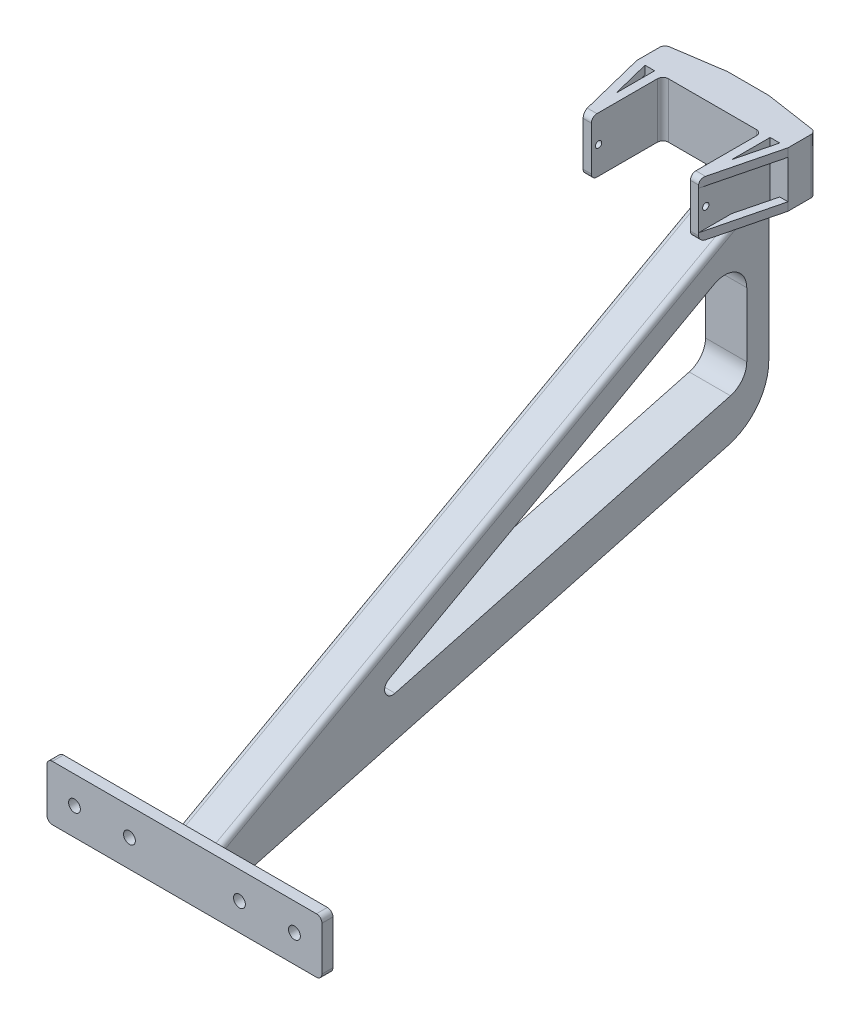
from build123d import *

# Parameters (mm, degrees)
SKETCH1_W           = 100
SKETCH1_H           = 20
SKETCH1_R           = 2.15
BOSS_EXTRUDE1_DEPTH = 4
BOSS_EXTRUDE2_DEPTH = 7.5
FILLET1_R           = 8
FILLET2_R           = 3
FILLET3_R           = 20
SKETCH5_W           = 9.5
SKETCH5_H           = 20
SKETCH5_W_2         = 10.5
SKETCH5_W_3         = 7.5
BOSS_EXTRUDE3_DEPTH = 5
SKETCH6_W           = 3
SKETCH6_H           = 20
BOSS_EXTRUDE4_DEPTH = 26
BOSS_EXTRUDE5_DEPTH = 3
LPATTERN2_COUNT     = 2
LPATTERN2_PITCH     = 17
SKETCH9_R           = 1.15
CUT_EXTRUDE1_DEPTH  = 264.565931031
BOSS_EXTRUDE6_DEPTH = 20
FILLET4_R           = 2
CHAMFER1_SIZE       = 3
CHAMFER2_SIZE       = 5
FILLET5_R           = 2
FILLET6_R           = 2
BOSS_EXTRUDE7_DEPTH = 15
FILLET7_R           = 2


with BuildPart() as part:
    # Sketch1 → Boss-Extrude1 (new body)
    with BuildSketch(Plane.XY):
        with Locations((50, 10)):
            Rectangle(SKETCH1_W, SKETCH1_H)
        with Locations((70, 10)):
            Circle(SKETCH1_R, mode=Mode.SUBTRACT)
        with Locations(Location((30, 10, 0), (0, 0, 180))):
            Circle(SKETCH1_R, mode=Mode.SUBTRACT)
        with Locations((10, 10)):
            Circle(SKETCH1_R, mode=Mode.SUBTRACT)
        with Locations(Location((90, 10, 0), (0, 0, 180))):
            Circle(SKETCH1_R, mode=Mode.SUBTRACT)
    extrude(amount=BOSS_EXTRUDE1_DEPTH)

    # Fillet6
    fillet6_edges = [part.edges().sort_by_distance(p)[0] for p in [
        (0, 20, 2),
        (100, 20, 2),
        (100, 0, 2),
        (0, 0, 2),
    ]]
    fillet(fillet6_edges, radius=FILLET6_R)



with BuildPart() as body_2:
    # Sketch4 → Boss-Extrude2 (new, symmetric)
    with BuildSketch(Plane.ZY.offset(-50)):
        Polygon((0, 2.5), (0, 17.5), (-1, 17.5), (-193, 123.393201871), (-193, 155), (-201, 155), (-201, 56.089838486), (-1, 2.5), align=None)
        Polygon((-41.271401161, 28.290689419), (-193, 68.946244947), (-193, 111.973122473), align=None, mode=Mode.SUBTRACT)
    extrude(amount=BOSS_EXTRUDE2_DEPTH, both=True)

    # Fillet1
    fillet1_edges = [body_2.edges().sort_by_distance(p)[0] for p in [
        (50, 111.973122473, -193),
        (50, 68.946244947, -193),
    ]]
    fillet(fillet1_edges, radius=FILLET1_R)

    # Fillet2
    fillet2_edges = [body_2.edges().sort_by_distance(p)[0] for p in [
        (50, 28.290689419, -41.271401161),
    ]]
    fillet(fillet2_edges, radius=FILLET2_R)

    # Fillet3
    fillet3_edges = [body_2.edges().sort_by_distance(p)[0] for p in [
        (50, 56.089838486, -201),
    ]]
    fillet(fillet3_edges, radius=FILLET3_R)

    # Sketch5 → Boss-Extrude3 (add, symmetric)
    with BuildSketch(Plane.XY.offset(-193)):
        with Locations((27.25, 145)):
            Rectangle(SKETCH5_W, SKETCH5_H)
        with Locations((37.25, 145)):
            Rectangle(SKETCH5_W_2, SKETCH5_H)
        with Locations((46.25, 145)):
            Rectangle(SKETCH5_W_3, SKETCH5_H)
        with Locations((53.75, 145)):
            Rectangle(SKETCH5_W_3, SKETCH5_H)
        with Locations((62.75, 145)):
            Rectangle(SKETCH5_W_2, SKETCH5_H)
        with Locations((72.75, 145)):
            Rectangle(SKETCH5_W, SKETCH5_H)
    extrude(amount=BOSS_EXTRUDE3_DEPTH, both=True)

    # Sketch6 → Boss-Extrude4 (add)
    with BuildSketch(Plane.XY.offset(-188)):
        with Locations((30.5, 145)):
            Rectangle(SKETCH6_W, SKETCH6_H)
        with Locations((69.5, 145)):
            Rectangle(SKETCH6_W, SKETCH6_H)
    extrude(amount=BOSS_EXTRUDE4_DEPTH)

    # Sketch8 → Boss-Extrude5 (add)
    with BuildSketch(Plane(origin=(0, 155, 0), x_dir=(1, 0, 0), z_dir=(0, 1, 0))):
        Polygon((22.5, 188), (29, 162), (29, 174), (25.5, 188), align=None)
        Polygon((74.5, 188), (77.5, 188), (71, 162), (71, 174), align=None)
    boss_extrude5 = extrude(amount=-BOSS_EXTRUDE5_DEPTH)

    # LPattern2: Boss-Extrude5 ×2
    with Locations(*[(0, -i * LPATTERN2_PITCH, 0) for i in range(1, LPATTERN2_COUNT)]):
        add(boss_extrude5)

    # Sketch9 → Cut-Extrude1 (cut, through all)
    with BuildSketch(Plane(origin=(71, 0, 0), x_dir=(0, 0, -1), z_dir=(1, 0, 0))):
        with Locations((164.6, 145)):
            Circle(SKETCH9_R)
    extrude(amount=-CUT_EXTRUDE1_DEPTH, mode=Mode.SUBTRACT)

    # Sketch10 → Boss-Extrude6 (add)
    with BuildSketch(Plane(origin=(0, 155, 0), x_dir=(1, 0, 0), z_dir=(0, 1, 0))):
        Polygon((57.5, 201), (57.5, 198), (77.5, 198), align=None)
        Polygon((42.5, 201), (42.5, 198), (22.5, 198), align=None)
    extrude(amount=-BOSS_EXTRUDE6_DEPTH)

    # Fillet4
    fillet4_edges = [body_2.edges().sort_by_distance(p)[0] for p in [
        (32, 145, -188),
        (68, 145, -188),
        (77.5, 145, -198),
        (22.5, 145, -198),
    ]]
    fillet(fillet4_edges, radius=FILLET4_R)

    # Chamfer1
    chamfer1_edges = [body_2.edges().sort_by_distance(p)[0] for p in [
        (50, 135, -193),
    ]]
    chamfer(chamfer1_edges, length=CHAMFER1_SIZE)

    # Chamfer2
    # the kernel refuses this chamfer: 5 mm, written as the material it adds along each edge
    with BuildSketch(Plane(origin=(57.5, 135, -177.14158506), x_dir=(0.9996219169112968, 0.0274958766105877, 0), z_dir=(0, 0, -1))) as chamfer2_piece_1_section:
        Polygon((CHAMFER2_SIZE * 0.999621916911, CHAMFER2_SIZE * 0.0274958766106), (-CHAMFER2_SIZE * 0.0274958766106, CHAMFER2_SIZE * 0.999621916911), (0, 0), align=None)
    chamfer2_piece_1 = extrude(amount=23.85841494, mode=Mode.PRIVATE)
    chamfer2_piece_1 = split(chamfer2_piece_1, bisect_by=Plane(origin=(57.857106813, 131.163616626, -193.836383374), z_dir=(0, -0.7071067811865476, 0.7071067811865476)), keep=Keep.TOP, mode=Mode.PRIVATE)
    chamfer2_piece_1 = split(chamfer2_piece_1, bisect_by=Plane(origin=(57.857106813, 130.884822168, -193), z_dir=(0, 0, -1)), keep=Keep.TOP, mode=Mode.PRIVATE)
    add(chamfer2_piece_1)
    with BuildSketch(Plane(origin=(57.5, 135, -177.14158506), x_dir=(0.9996219169112968, 0.0274958766105877, 0), z_dir=(0, 0, -1))) as chamfer2_piece_2_section:
        Polygon((CHAMFER2_SIZE * 0.999621916911, CHAMFER2_SIZE * 0.0274958766106), (-CHAMFER2_SIZE * 0.0274958766106, CHAMFER2_SIZE * 0.999621916911), (0, 0), align=None)
    chamfer2_piece_2 = extrude(amount=23.85841494, mode=Mode.PRIVATE)
    chamfer2_piece_2 = split(chamfer2_piece_2, bisect_by=Plane(origin=(59.611963913, 133.659604806, -191.340395194), z_dir=(0, 0.7071067811865476, -0.7071067811865476)), keep=Keep.TOP, mode=Mode.PRIVATE)
    chamfer2_piece_2 = split(chamfer2_piece_2, bisect_by=Plane(origin=(59.611963913, 134.212806408, -193), z_dir=(0, 0, 1)), keep=Keep.TOP, mode=Mode.PRIVATE)
    add(chamfer2_piece_2)
    with BuildSketch(Plane(origin=(57.5, 135, -177.14158506), x_dir=(0.9996219169112968, 0.0274958766105877, 0), z_dir=(0, 0, -1))) as chamfer2_piece_3_section:
        Polygon((CHAMFER2_SIZE * 0.999621916911, CHAMFER2_SIZE * 0.0274958766106), (-CHAMFER2_SIZE * 0.0274958766106, CHAMFER2_SIZE * 0.999621916911), (0, 0), align=None)
    chamfer2_piece_3 = extrude(amount=23.85841494, mode=Mode.PRIVATE)
    chamfer2_piece_3 = split(chamfer2_piece_3, bisect_by=Plane(origin=(59.139397436, 130.720913617, -194.279086383), z_dir=(0, 0.7071067811865476, -0.7071067811865476)), keep=Keep.TOP, mode=Mode.PRIVATE)
    chamfer2_piece_3 = split(chamfer2_piece_3, bisect_by=Plane(origin=(59.699836307, 133.375592649, -200.670024554), z_dir=(-0.14834045293024603, 0, 0.9889363528682974)), keep=Keep.TOP, mode=Mode.PRIVATE)
    chamfer2_piece_3 = split(chamfer2_piece_3, bisect_by=Plane(origin=(59.139397436, 133.375592649, -193), z_dir=(0, 0, -1)), keep=Keep.TOP, mode=Mode.PRIVATE)
    add(chamfer2_piece_3)
    with BuildSketch(Plane(origin=(42.5, 135, -201), x_dir=(-0.9996219169112968, 0.0274958766105877, 0), z_dir=(0, 0, 1))) as chamfer2_piece_4_section:
        Polygon((CHAMFER2_SIZE * 0.999621916911, CHAMFER2_SIZE * 0.0274958766106), (-CHAMFER2_SIZE * 0.0274958766106, CHAMFER2_SIZE * 0.999621916911), (0, 0), align=None)
    chamfer2_piece_4 = extrude(amount=23.85841494, mode=Mode.PRIVATE)
    chamfer2_piece_4 = split(chamfer2_piece_4, bisect_by=Plane(origin=(40.860602564, 130.720913617, -194.279086383), z_dir=(0, 0.7071067811865476, -0.7071067811865476)), keep=Keep.TOP, mode=Mode.PRIVATE)
    chamfer2_piece_4 = split(chamfer2_piece_4, bisect_by=Plane(origin=(40.300163693, 133.375592649, -200.670024554), z_dir=(0.1483404529302461, 0, 0.9889363528682974)), keep=Keep.TOP, mode=Mode.PRIVATE)
    chamfer2_piece_4 = split(chamfer2_piece_4, bisect_by=Plane(origin=(40.860602564, 133.375592649, -193), z_dir=(0, 0, -1)), keep=Keep.TOP, mode=Mode.PRIVATE)
    add(chamfer2_piece_4)
    with BuildSketch(Plane(origin=(42.5, 135, -201), x_dir=(-0.9996219169112968, 0.0274958766105877, 0), z_dir=(0, 0, 1))) as chamfer2_piece_5_section:
        Polygon((CHAMFER2_SIZE * 0.999621916911, CHAMFER2_SIZE * 0.0274958766106), (-CHAMFER2_SIZE * 0.0274958766106, CHAMFER2_SIZE * 0.999621916911), (0, 0), align=None)
    chamfer2_piece_5 = extrude(amount=23.85841494, mode=Mode.PRIVATE)
    chamfer2_piece_5 = split(chamfer2_piece_5, bisect_by=Plane(origin=(42.142893187, 131.163616626, -193.836383374), z_dir=(0, -0.7071067811865476, 0.7071067811865476)), keep=Keep.TOP, mode=Mode.PRIVATE)
    chamfer2_piece_5 = split(chamfer2_piece_5, bisect_by=Plane(origin=(42.142893187, 130.884822168, -193), z_dir=(0, 0, -1)), keep=Keep.TOP, mode=Mode.PRIVATE)
    add(chamfer2_piece_5)
    with BuildSketch(Plane(origin=(42.5, 135, -201), x_dir=(-0.9996219169112968, 0.0274958766105877, 0), z_dir=(0, 0, 1))) as chamfer2_piece_6_section:
        Polygon((CHAMFER2_SIZE * 0.999621916911, CHAMFER2_SIZE * 0.0274958766106), (-CHAMFER2_SIZE * 0.0274958766106, CHAMFER2_SIZE * 0.999621916911), (0, 0), align=None)
    chamfer2_piece_6 = extrude(amount=23.85841494, mode=Mode.PRIVATE)
    chamfer2_piece_6 = split(chamfer2_piece_6, bisect_by=Plane(origin=(40.388036087, 133.659604806, -191.340395194), z_dir=(0, 0.7071067811865476, -0.7071067811865476)), keep=Keep.TOP, mode=Mode.PRIVATE)
    chamfer2_piece_6 = split(chamfer2_piece_6, bisect_by=Plane(origin=(40.388036087, 134.212806408, -193), z_dir=(0, 0, 1)), keep=Keep.TOP, mode=Mode.PRIVATE)
    add(chamfer2_piece_6)

    # Fillet5
    fillet5_edges = [body_2.edges().sort_by_distance(p)[0] for p in [
        (30.5, 155, -162),
        (30.5, 135, -162),
        (69.5, 155, -162),
        (69.5, 135, -162),
    ]]
    fillet(fillet5_edges, radius=FILLET5_R)


with BuildPart() as part_1:
    add(part.part)

    add(body_2.part)  # Boss-Extrude7 merges body 2
    # Sketch11 → Boss-Extrude7 (add)
    with BuildSketch(Plane(origin=(0, 17.5, 0), x_dir=(1, 0, 0), z_dir=(0, 1, 0))):
        Polygon((57.5, 1), (57.5, 0), (66.5, 0), align=None)
        Polygon((42.5, 1), (42.5, 0), (33.5, 0), align=None)
    extrude(amount=-BOSS_EXTRUDE7_DEPTH)

    # Fillet7
    fillet7_edges = [part_1.edges().sort_by_distance(p)[0] for p in [
        (57.5, 70.446600935, -97),
        (42.5, 70.446600935, -97),
    ]]
    fillet(fillet7_edges, radius=FILLET7_R)


solid = part_1.part
